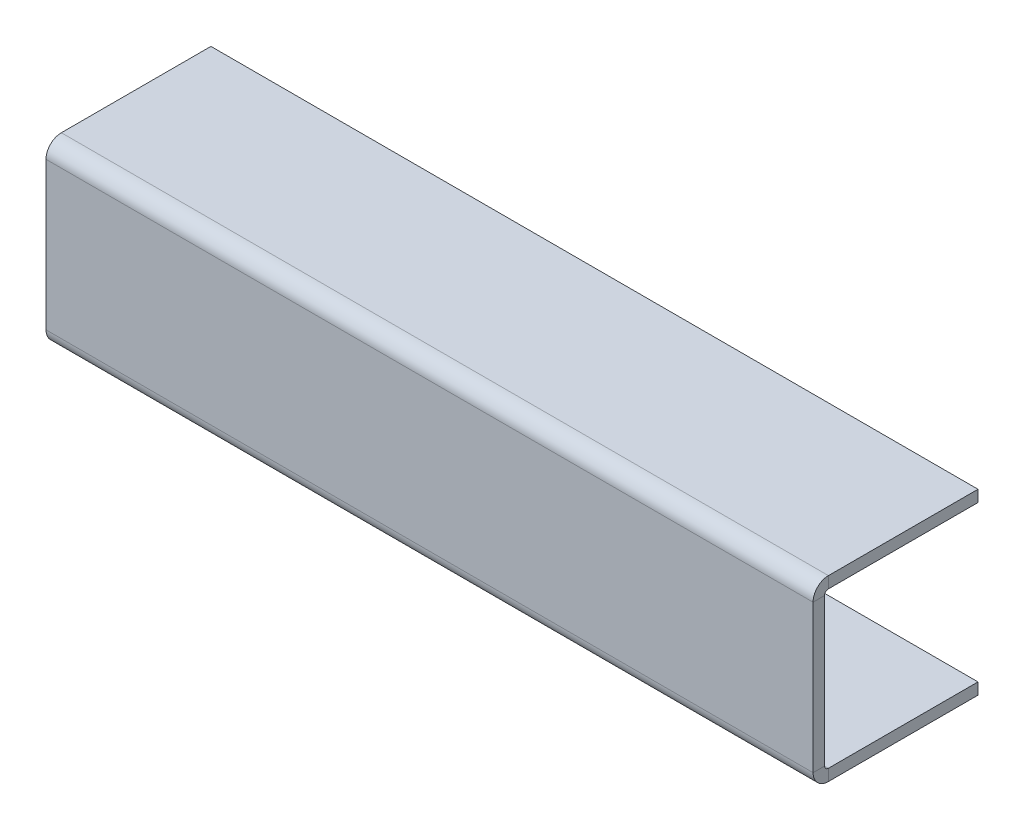
from build123d import *

# Parameters (mm, degrees)
BOSS_EXTRUDE1_DEPTH    = 100
CONVERT_SOLID1_START   = -100
CONVERT_SOLID1_DEPTH   = 200
CONVERT_SOLID1_2_DEPTH = 200


# Read off the part's stored shape, not the designer's step: Convert-Solid1
with BuildPart() as part:
    # Sketch1 → Boss-Extrude1 (new, symmetric)
    with BuildSketch(Plane(origin=(0, 0, 0), x_dir=(0, 0, -1), z_dir=(1, 0, 0))):
        Polygon((0, 0), (0, -40.5), (40, -40.5), (40, -43.5), (-3, -43.5), (-3, 3), (40, 3), (40, 0), align=None)
    extrude(amount=BOSS_EXTRUDE1_DEPTH, both=True)

    # Convert-Solid1 outline → Convert-Solid1 (cut)
    with BuildSketch(Plane.YZ.offset(CONVERT_SOLID1_START)):
        with BuildLine():
            Line((3, 3), (-1, 3))
            ThreePointArc((-1, 3), (1.828427125, 1.828427125), (3, -1))
            Line((3, -1), (3, 3))
        make_face()
        with BuildLine():
            ThreePointArc((-43.5, -1), (-42.328427125, 1.828427125), (-39.5, 3))
            Line((-39.5, 3), (-43.5, 3))
            Line((-43.5, 3), (-43.5, -1))
        make_face()
    extrude(amount=CONVERT_SOLID1_DEPTH, mode=Mode.SUBTRACT)

    # Convert-Solid1 2 outline → Convert-Solid1 2 (add)
    with BuildSketch(Plane.YZ.offset(CONVERT_SOLID1_START)):
        with BuildLine():
            Line((0, 0), (-1, 0))
            ThreePointArc((-1, 0), (-0.292893219, -0.292893219), (0, -1))
            Line((0, -1), (0, 0))
        make_face()
        with BuildLine():
            ThreePointArc((-40.5, -1), (-40.207106781, -0.292893219), (-39.5, 0))
            Line((-39.5, 0), (-40.5, 0))
            Line((-40.5, 0), (-40.5, -1))
        make_face()
    extrude(amount=CONVERT_SOLID1_2_DEPTH)


solid = part.part
